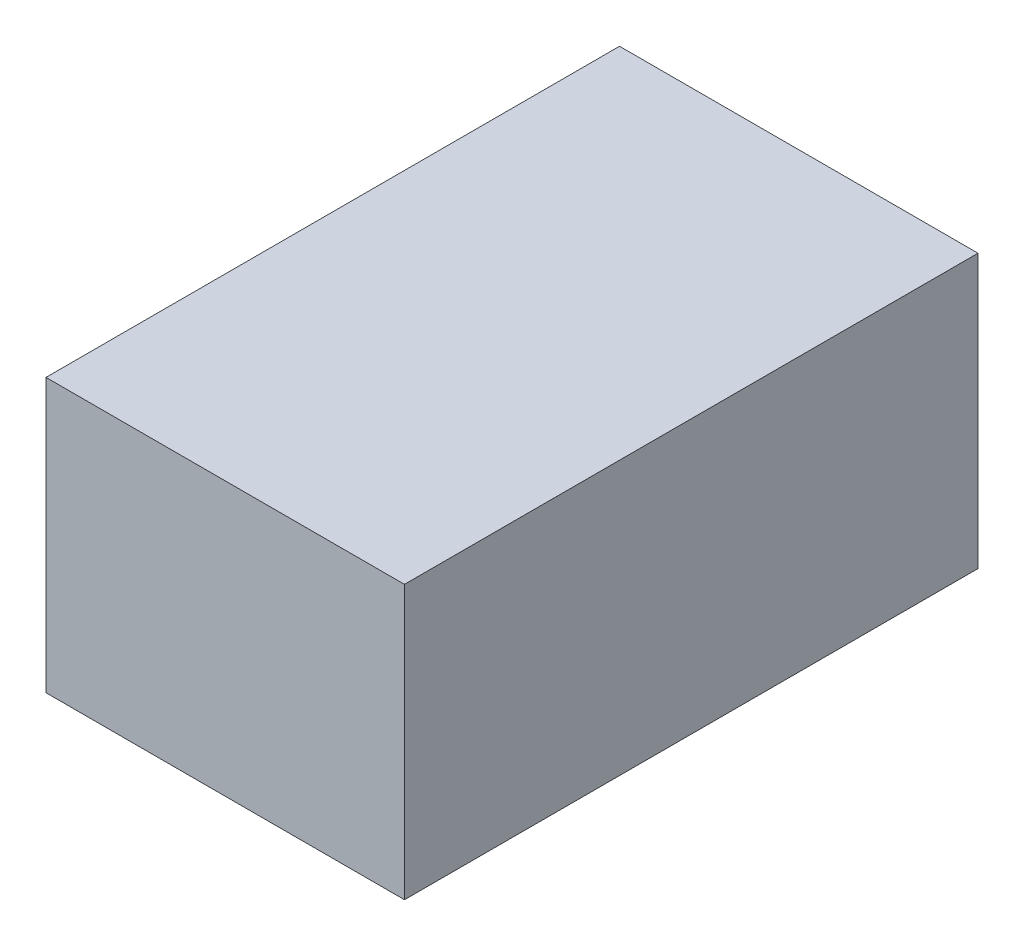
from build123d import *

# Parameters (mm, degrees)
SKETCH1_W           = 10
SKETCH1_H           = 16
BOSS_EXTRUDE1_DEPTH = 7.62


with BuildPart() as part:
    # Sketch1 → Boss-Extrude1 (new body)
    with BuildSketch(Plane(origin=(0, 0, 0), x_dir=(1, 0, 0), z_dir=(0, 1, 0))):
        with Locations((5, 8)):
            Rectangle(SKETCH1_W, SKETCH1_H)
    extrude(amount=BOSS_EXTRUDE1_DEPTH)


solid = part.part
